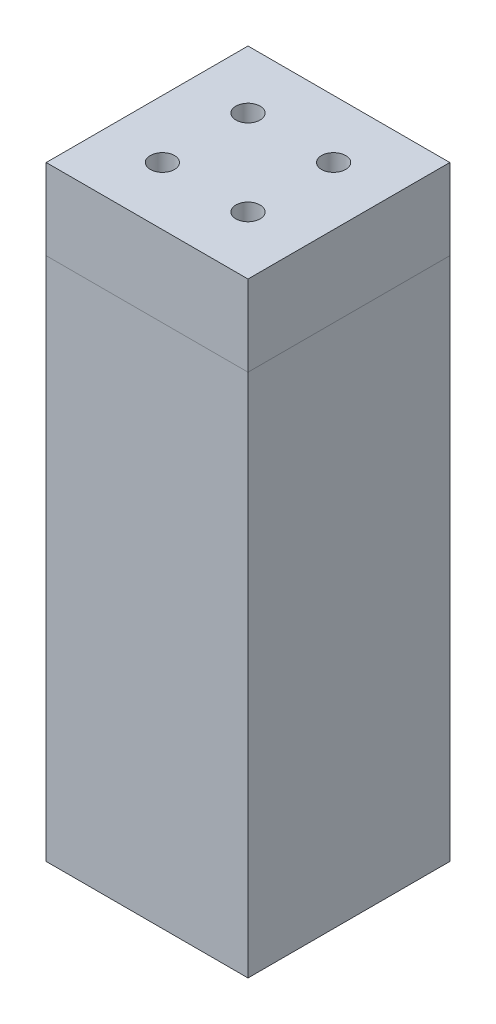
from build123d import *

# Parameters (mm, degrees)
SKETCH1_W                 = 25
SKETCH1_H                 = 25
BOSS_EXTRUDE1_DEPTH       = 75
M3X0_5_TAPPED_HOLE1_D     = 3
M3X0_5_TAPPED_HOLE1_DEPTH = 35
M3X0_5_TAPPED_HOLE1_TIP   = 0.901290929


with BuildPart() as part:
    # Sketch1 → Boss-Extrude1 (new body)
    with BuildSketch(Plane(origin=(0, 0, 0), x_dir=(1, 0, 0), z_dir=(0, 1, 0))):
        Rectangle(SKETCH1_W, SKETCH1_H)
    extrude(amount=BOSS_EXTRUDE1_DEPTH)

    # M3x0.5 Tapped Hole1
    with Locations(Plane(origin=(0, 75, 0), x_dir=(1, 0, 0), z_dir=(0, 1, 0))):
        with Locations((-5.303300859, -5.303300859), (5.303300859, -5.303300859), (5.303300859, 5.303300859), (-5.303300859, 5.303300859)):
            Hole(M3X0_5_TAPPED_HOLE1_D / 2, depth=M3X0_5_TAPPED_HOLE1_DEPTH)
            with Locations((0, 0, -(M3X0_5_TAPPED_HOLE1_DEPTH + M3X0_5_TAPPED_HOLE1_TIP / 2))):  # 118° drill point
                Cone(0, M3X0_5_TAPPED_HOLE1_D / 2, M3X0_5_TAPPED_HOLE1_TIP, mode=Mode.SUBTRACT)


solid = part.part
